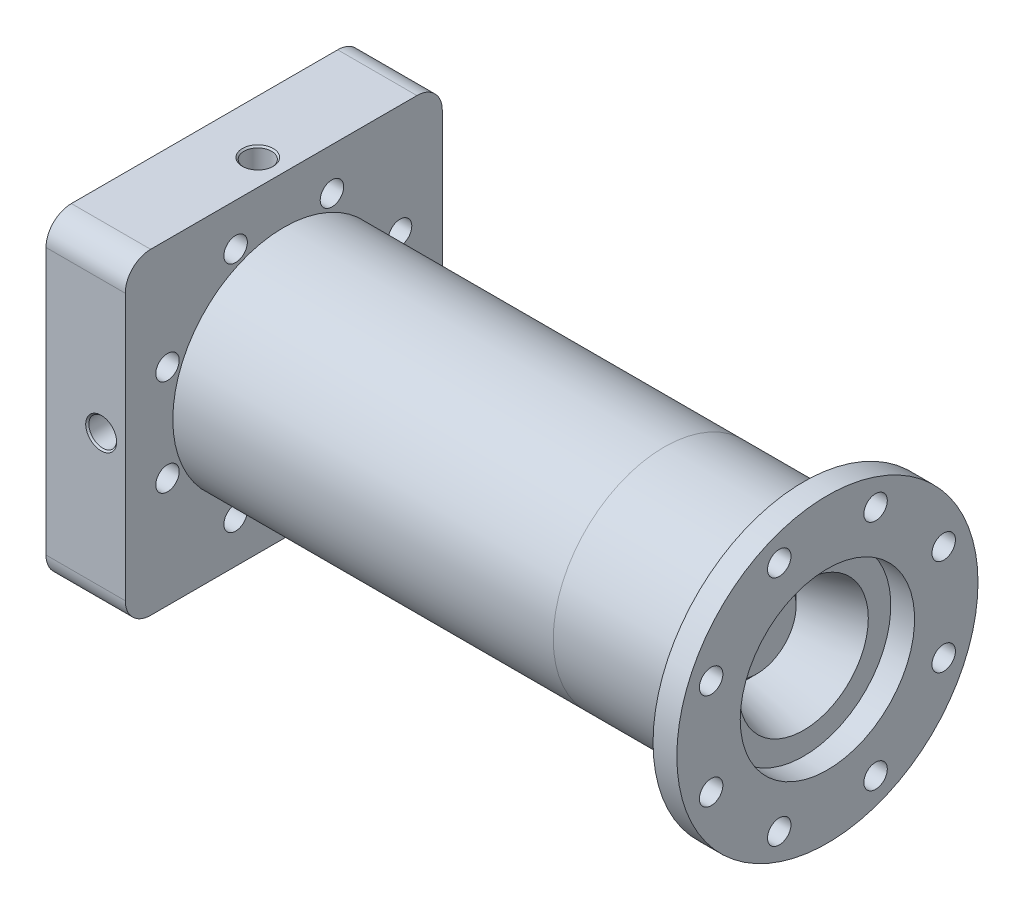
from build123d import *

# Parameters (mm, degrees)
FILLET1_R               = 1.27
CUT_EXTRUDE1_REACH      = 250.969
SKETCH2_R               = 3.81
CIRPATTERN1_COUNT       = 8
SKETCH4_R               = 63.5
BOSS_EXTRUDE1_DEPTH     = 31.75
SKETCH11_W              = 127
SKETCH11_H              = 127
BOSS_EXTRUDE2_DEPTH     = 31.75
SKETCH12_R              = 24.13
CUT_EXTRUDE4_DEPTH      = 16.51
CUT_EXTRUDE5_START      = -39.450428193
CUT_EXTRUDE5_OUTLINE_R  = 1.9685
CUT_EXTRUDE5_DEPTH      = 39.450428193
CHAMFER1_SIZE           = 4.572
FILLET2_R               = 0.889
FILLET3_R               = 0.508
CUT_EXTRUDE9_REACH      = 274.181
CUT_EXTRUDE9_END_RADIUS = 24.13
SKETCH31_R              = 1.5875
SKETCH33_R              = 44.45
SKETCH33_R_2            = 34.925
BOSS_EXTRUDE4_DEPTH     = 152.4
FILLET5_R               = 1.27
FILLET6_R               = 10.16
SKETCH39_R              = 60.325
SKETCH39_R_2            = 34.925
BOSS_EXTRUDE6_DEPTH     = 9.525
SKETCH40_R              = 4.699
CUT_EXTRUDE13_DEPTH     = 257.249627432
CIRPATTERN3_COUNT       = 8
SKETCH44_R              = 1.7653


# Read off the part's stored shape, not the designer's step: Cut-Extrude5
with BuildPart() as part:
    # Chamber Revolve → Revolve1 (revolve)
    with BuildSketch(Plane.XY, mode=Mode.PRIVATE) as revolve1_sk:
        with BuildLine():
            Line((232.209399825, 63.5), (232.209399825, 25.908))
            Line((232.209399825, 25.908), (191.916500941, 15.111550283))
            ThreePointArc((191.916500941, 15.111550283), (190.601700192, 15.111550283), (189.463049342, 15.768950658))
            Line((189.463049342, 15.768950658), (175.768, 29.464))
            Line((175.768, 29.464), (0, 29.464))
            Line((0, 29.464), (0, 38.1))
            Line((0, 38.1), (3.8608, 38.1))
            Line((3.8608, 38.1), (3.8608, 44.1706))
            Line((3.8608, 44.1706), (0, 44.1706))
            Line((0, 44.1706), (0, 63.5))
            Line((0, 63.5), (10.16, 63.5))
            Line((10.16, 63.5), (10.16, 43.18))
            Line((10.16, 43.18), (24.13, 43.18))
            Line((24.13, 43.18), (24.13, 63.5))
            Line((24.13, 63.5), (232.209399825, 63.5))
        make_face()
    revolve(revolve1_sk.sketch.rotate(Axis((0, 0, 0), (1, 0, 0)), 90), axis=Axis((0, 0, 0), (1, 0, 0)))

    # Fillet1
    fillet1_edges = [part.edges().sort_by_distance(p)[0] for p in [
        (24.13, 0, -43.18),
        (10.16, 0, -43.18),
    ]]
    fillet(fillet1_edges, radius=FILLET1_R)

    # Sketch2 → Cut-Extrude1 (cut, up to next)
    with BuildSketch(Plane.ZY, mode=Mode.PRIVATE) as cut_extrude1_sk1:
        with Locations((-21.773156568, 52.565049882)):
            Circle(SKETCH2_R)
    cut_extrude1_tool1 = extrude(cut_extrude1_sk1.sketch, amount=-CUT_EXTRUDE1_REACH, mode=Mode.PRIVATE) & part.part
    cut_extrude1 = cut_extrude1_tool1.solids().sort_by_distance((0, 52.56505, -21.773157))[0]
    add(cut_extrude1, mode=Mode.SUBTRACT)

    # CirPattern1: Cut-Extrude1 ×8 about axis
    cirpattern1_axis = Axis((0, 0, 0), (1, 0, 0))
    for i in range(1, CIRPATTERN1_COUNT):
        add(cut_extrude1.rotate(cirpattern1_axis, i * 360 / CIRPATTERN1_COUNT), mode=Mode.SUBTRACT)

    # Fillet2
    fillet2_edges = [part.edges().sort_by_distance(p)[0] for p in [
        (3.8608, 0, -38.1),
        (3.8608, 0, -44.1706),
    ]]
    fillet(fillet2_edges, radius=FILLET2_R)


with BuildPart() as body_2:
    # Sketch4 → Boss-Extrude1 (new body)
    with BuildSketch(Plane.ZY):
        Circle(SKETCH4_R)
    extrude(amount=BOSS_EXTRUDE1_DEPTH)

    # Sketch11 → Boss-Extrude2 (add)
    with BuildSketch(Plane.ZY.offset(31.75)):
        Rectangle(SKETCH11_W, SKETCH11_H)
    extrude(amount=-BOSS_EXTRUDE2_DEPTH)

    # Sketch12 → Cut-Extrude4 (cut)
    with BuildSketch(Plane(origin=(0, 0, 0), x_dir=(0, 0, -1), z_dir=(1, 0, 0))):
        Circle(SKETCH12_R)
    extrude(amount=-CUT_EXTRUDE4_DEPTH, mode=Mode.SUBTRACT)

    # Cut-Extrude5 outline → Cut-Extrude5 (cut)
    with BuildSketch(Plane.XY.offset(63.5).offset(CUT_EXTRUDE5_START)):
        with Locations((-9.652, 0)):
            Circle(CUT_EXTRUDE5_OUTLINE_R)
    cut_extrude5 = extrude(amount=CUT_EXTRUDE5_DEPTH, mode=Mode.SUBTRACT)

    # Chamfer1
    chamfer1_edges = [body_2.edges().sort_by_distance(p)[0] for p in [
        (0, 0, 24.13),
    ]]
    chamfer(chamfer1_edges, length=CHAMFER1_SIZE)

    # Sketch20 → 7/16 (0.4375) Diameter Hole1 (revolve, cut)
    with BuildSketch(Plane(origin=(-9.652, 0, 63.5), x_dir=(0, -1, 0), z_dir=(1, 0, 0))):
        Polygon((0, 0), (0, 22.388531814), (5.55625, 19.05), (5.55625, 0.635), (6.19125, 0), align=None)
    f_7_16_0_4375_diameter_hole1 = revolve(axis=Axis((-9.652, 0, 69.85), (0, 0, -1)), mode=Mode.SUBTRACT)

    # Mirror1: Cut-Extrude5, 7/16 (0.4375) Diameter Hole1 across plane
    add(cut_extrude5.mirror(Plane.XY), mode=Mode.SUBTRACT)
    add(f_7_16_0_4375_diameter_hole1.mirror(Plane.XY), mode=Mode.SUBTRACT)

    # Sketch23 → Ø6.7 (6.7) Diameter Hole1 (revolve, cut)
    with BuildSketch(Plane(origin=(-31.75, -33.02, 0), x_dir=(0, 0, 1), z_dir=(0, 1, 0))):
        Polygon((0, 0), (0, 15.220883074), (3.35, 13.208), (3.35, 0.4), (3.75, 0), align=None)
    f_6_7_6_7_diameter_hole1 = revolve(axis=Axis((-38.1, -33.02, 0), (1, 0, 0)), mode=Mode.SUBTRACT)

    # Mirror2: Ø6.7 (6.7) Diameter Hole1 across plane
    add(f_6_7_6_7_diameter_hole1.mirror(Plane.ZX), mode=Mode.SUBTRACT)

    # Sketch24 → Cut-Revolve1 (revolve, cut)
    with BuildSketch(Plane(origin=(0, 0, 0), x_dir=(1, 0, 0), z_dir=(0, 1, 0))):
        with BuildLine():
            Line((-31.75, 7.1374), (-30.958106371, 5.7658))
            Line((-30.958106371, 5.7658), (-29.845, 5.7658))
            ThreePointArc((-29.845, 5.7658), (-29.650596816, 5.727130803), (-29.485789755, 5.617010245))
            Line((-29.485789755, 5.617010245), (-28.73287951, 4.8641))
            Line((-28.73287951, 4.8641), (-16.51, 4.8641))
            Line((-16.51, 4.8641), (-16.51, 0))
            Line((-16.51, 0), (-31.75, 0))
            Line((-31.75, 0), (-31.75, 7.1374))
        make_face()
    revolve(axis=Axis((232.209399825, 0, 0), (-1, 0, 0)), mode=Mode.SUBTRACT)

    # Fillet3
    fillet3_edges = [body_2.edges().sort_by_distance(p)[0] for p in [
        (-30.958106371, 0, 5.7658),
    ]]
    fillet(fillet3_edges, radius=FILLET3_R)

    # Sketch30 → 7/16 (0.4375) Diameter Hole2 (revolve, cut)
    with BuildSketch(Plane(origin=(-10.414, -63.5, 0), x_dir=(0, 0, -1), z_dir=(1, 0, 0))):
        Polygon((0, 0), (0, 22.388531814), (5.55625, 19.05), (5.55625, 0.635), (6.19125, 0), align=None)
    f_7_16_0_4375_diameter_hole2 = revolve(axis=Axis((-10.414, -69.85, 0), (0, 1, 0)), mode=Mode.SUBTRACT)

    # Cut-Extrude9: up to this cylinder (the profile starts outside it)
    cut_extrude9_end = Plane(origin=(-10.414, 0, 0), z_dir=(1, 0, 0)) * Cylinder(CUT_EXTRUDE9_END_RADIUS, 597.622, mode=Mode.PRIVATE)
    # Sketch31 → Cut-Extrude9 (cut, up to the surface)
    with BuildSketch(Plane.XZ.offset(63.5), mode=Mode.PRIVATE) as cut_extrude9_sk1:
        with Locations(Location((-10.414, 0, 0), (0, 0, 270))):
            Circle(SKETCH31_R)
    cut_extrude9_tool1 = extrude(cut_extrude9_sk1.sketch, amount=-CUT_EXTRUDE9_REACH, mode=Mode.PRIVATE) - cut_extrude9_end
    cut_extrude9 = cut_extrude9_tool1.solids().sort_by_distance((-10.414, -63.5, 0))[0]
    add(cut_extrude9, mode=Mode.SUBTRACT)

    # Mirror3: 7/16 (0.4375) Diameter Hole2, Cut-Extrude9 across plane
    add(f_7_16_0_4375_diameter_hole2.mirror(Plane.ZX), mode=Mode.SUBTRACT)
    add(cut_extrude9.mirror(Plane.ZX), mode=Mode.SUBTRACT)

    # Fillet6
    fillet6_edges = [body_2.edges().sort_by_distance(p)[0] for p in [
        (-15.875, -63.5, 63.5),
        (-15.875, 63.5, 63.5),
        (-15.875, -63.5, -63.5),
        (-15.875, 63.5, -63.5),
    ]]
    fillet(fillet6_edges, radius=FILLET6_R)


with BuildPart() as body_3:
    # Sketch21 → Revolve2 (revolve)
    with BuildSketch(Plane(origin=(0, 0, 0), x_dir=(1, 0, 0), z_dir=(0, 1, 0))):
        Polygon((0, 29.464), (175.768, 29.464), (189.463049342, 15.768950658), (189.463049342, 0), (0, 0), align=None)
    revolve(axis=Axis((189.463049342, 0, 0), (1, 0, 0)))


with BuildPart() as body_3_2:
    # Sketch33 → Boss-Extrude4 (new body)
    with BuildSketch(Plane(origin=(0, 0, 0), x_dir=(0, 0, -1), z_dir=(1, 0, 0))):
        with Locations(Location((0, 0, 0), (0, 0, 180))):
            Circle(SKETCH33_R)
        with Locations(Location((0, 0, 0), (0, 0, 180))):
            Circle(SKETCH33_R_2, mode=Mode.SUBTRACT)
    extrude(amount=BOSS_EXTRUDE4_DEPTH)


with BuildPart() as body_4:
    # Sketch34 → Revolve3 (revolve)
    with BuildSketch(Plane.XY, mode=Mode.PRIVATE) as revolve3_sk:
        Polygon((152.4, 44.45), (152.4, 34.925), (166.539290819, 14.732), (208.248690644, 25.908), (208.248690644, 44.45), align=None)
    revolve(revolve3_sk.sketch.rotate(Axis((152.4, 0, 0), (-1, 0, 0)), 90), axis=Axis((152.4, 0, 0), (-1, 0, 0)))

    # Fillet5
    fillet5_edges = [body_4.edges().sort_by_distance(p)[0] for p in [
        (166.539290819, 0, 14.732),
    ]]
    fillet(fillet5_edges, radius=FILLET5_R)

    # Sketch45 → Cut-Revolve3 (revolve, cut)
    with BuildSketch(Plane.XY, mode=Mode.PRIVATE) as cut_revolve3_sk:
        with BuildLine():
            Line((152.4, 41.4274), (154.5336, 41.4274))
            ThreePointArc((154.5336, 41.4274), (154.892810245, 41.278610245), (155.0416, 40.9194))
            Line((155.0416, 40.9194), (155.0416, 37.846))
            ThreePointArc((155.0416, 37.846), (154.892810245, 37.486789755), (154.5336, 37.338))
            Line((154.5336, 37.338), (152.4, 37.338))
            Line((152.4, 37.338), (152.4, 41.4274))
        make_face()
    revolve(cut_revolve3_sk.sketch.rotate(Axis((0, 0, 0), (1, 0, 0)), 90), axis=Axis((0, 0, 0), (1, 0, 0)), mode=Mode.SUBTRACT)


with BuildPart() as body_5:
    # Sketch39 → Boss-Extrude6 (new body)
    with BuildSketch(Plane(origin=(208.248690644, 0, 0), x_dir=(0, 0, -1), z_dir=(1, 0, 0))):
        with Locations(Location((0, 0, 0), (0, 0, 180))):
            Circle(SKETCH39_R)
        with Locations(Location((0, 0, 0), (0, 0, 180))):
            Circle(SKETCH39_R_2, mode=Mode.SUBTRACT)
    extrude(amount=BOSS_EXTRUDE6_DEPTH)


with BuildPart() as cut_extrude13_tool:
    # Sketch40 → Cut-Extrude13 (new, symmetric)
    with BuildSketch(Plane.ZY.offset(-208.248690644)):
        with Locations(Location((-19.294515976, 46.58108215, 0), (0, 0, 180))):
            Circle(SKETCH40_R)
    cut_extrude13 = extrude(amount=CUT_EXTRUDE13_DEPTH, both=True)


with BuildPart() as body_2_1:
    add(body_2.part)

    # Cut-Extrude13: cut by cut_extrude13_tool
    add(cut_extrude13_tool.part, mode=Mode.SUBTRACT)


with BuildPart() as body_5_1:
    add(body_5.part)

    # Cut-Extrude13: cut by cut_extrude13_tool
    add(cut_extrude13_tool.part, mode=Mode.SUBTRACT)


with BuildPart() as cirpattern3_tool:
    # CirPattern3: Cut-Extrude13 ×8 about axis
    cirpattern3_axis = Axis((0, 0, 0), (1, 0, 0))
    for i in range(1, CIRPATTERN3_COUNT):
        add(cut_extrude13.rotate(cirpattern3_axis, i * 360 / CIRPATTERN3_COUNT))


with BuildPart() as body_2_2:
    add(body_2_1.part)

    # CirPattern3: cut by cirpattern3_tool
    add(cirpattern3_tool.part, mode=Mode.SUBTRACT)

    # Sketch41 → Cut-Revolve2 (revolve, cut)
    with BuildSketch(Plane.XY, mode=Mode.PRIVATE) as cut_revolve2_sk:
        with BuildLine():
            Line((0, 37.338), (-2.1844, 37.338))
            ThreePointArc((-2.1844, 37.338), (-2.50768922, 37.47191078), (-2.6416, 37.7952))
            Line((-2.6416, 37.7952), (-2.6416, 40.9702))
            ThreePointArc((-2.6416, 40.9702), (-2.50768922, 41.29348922), (-2.1844, 41.4274))
            Line((-2.1844, 41.4274), (0, 41.4274))
            Line((0, 41.4274), (0, 37.338))
        make_face()
    revolve(cut_revolve2_sk.sketch.rotate(Axis((0, 0, 0), (1, 0, 0)), 90), axis=Axis((0, 0, 0), (1, 0, 0)), mode=Mode.SUBTRACT)


with BuildPart() as body_5_2:
    add(body_5_1.part)

    # CirPattern3: cut by cirpattern3_tool
    add(cirpattern3_tool.part, mode=Mode.SUBTRACT)


with BuildPart() as body_6:
    # Sketch44 → Revolve4 (revolve)
    with BuildSketch(Plane.XY, mode=Mode.PRIVATE) as revolve4_sk:
        with Locations((-0.8763, 39.6621)):
            Circle(SKETCH44_R)
    revolve(revolve4_sk.sketch.rotate(Axis((0, 0, 0), (1, 0, 0)), 90), axis=Axis((0, 0, 0), (1, 0, 0)))


with BuildPart() as body_7:
    # Mirror9: mirrored copy
    add(body_6.part.mirror(Plane(origin=(76.2, 0, 0), x_dir=(0, 0, 1), z_dir=(1, 0, 0))))


solid = Compound([body_3.part, body_3_2.part, body_4.part, body_2_2.part, body_5_2.part, body_6.part, body_7.part])
